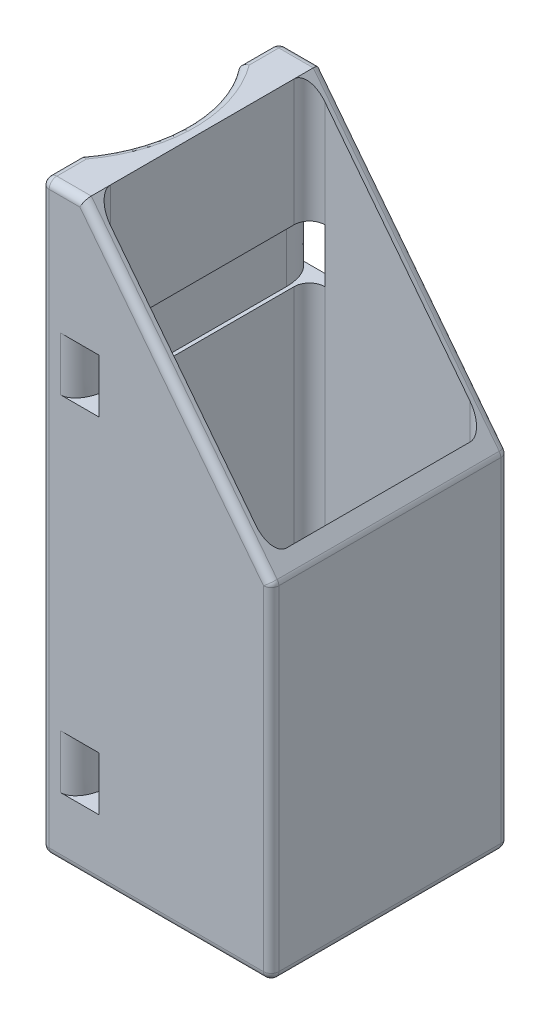
from build123d import *

# Parameters (mm, degrees)
SKETCH1_W           = 23
SKETCH1_H           = 28
BOSS_EXTRUDE1_DEPTH = 75
BOSS_EXTRUDE2_DEPTH = 1.5
CUT_EXTRUDE1_DEPTH  = 87.521673585
FILLET1_R           = 1
SKETCH7_W           = 2
SKETCH7_H           = 7
CUT_EXTRUDE2_DEPTH  = 87.521673672
SKETCH8_W           = 31
SKETCH8_H           = 7
CUT_EXTRUDE3_DEPTH  = 0.5
FILLET2_SIZE        = 2.5
FILLET2_SIZE_2      = 4
FILLET3_R           = 2


with BuildPart() as part:
    # Sketch1 → Boss-Extrude1 (new body)
    with BuildSketch(Plane(origin=(0, 0, 0), x_dir=(1, 0, 0), z_dir=(0, 1, 0))):
        with BuildLine():
            Line((0, 0), (30, 0))
            Line((30, 0), (30, 31))
            Line((30, 31), (0, 31))
            Line((0, 31), (0, 25.798058069))
            ThreePointArc((0, 25.798058069), (3.5, 15.5), (0, 5.201941931))
            Line((0, 5.201941931), (0, 0))
        make_face()
        with Locations((17, 15.5)):
            Rectangle(SKETCH1_W, SKETCH1_H, mode=Mode.SUBTRACT)
    extrude(amount=BOSS_EXTRUDE1_DEPTH)

    # Sketch2 → Boss-Extrude2 (add)
    with BuildSketch(Plane.XZ):
        with BuildLine():
            Line((0, -25.798058069), (0, -31))
            Line((0, -31), (30, -31))
            Line((30, -31), (30, 0))
            Line((30, 0), (0, 0))
            Line((0, 0), (0, -5.201941931))
            ThreePointArc((0, -5.201941931), (3.55300213, -15.5), (0, -25.798058069))
        make_face()
    extrude(amount=BOSS_EXTRUDE2_DEPTH)

    # Sketch6 → Cut-Extrude1 (cut, through all)
    with BuildSketch(Plane.XY):
        Polygon((5.5, 75), (30, 43.5), (30, 75), align=None)
    extrude(amount=-CUT_EXTRUDE1_DEPTH, mode=Mode.SUBTRACT)

    # Fillet1
    fillet1_edges = [part.edges().sort_by_distance(p)[0] for p in [
        (0, 36.75, -31),
        (0, 36.75, 0),
        (0, 75, -28.399029035),
        (3.5, 75, -15.5),
        (0, -1.5, -2.600970965),
        (3.55300213, -1.5, -15.5),
        (0, -1.5, -28.399029035),
        (15, -1.5, -31),
        (30, -1.5, -15.5),
        (15, -1.5, 0),
        (0, 75, -2.600970965),
        (30, 21, -31),
        (2.75, 75, -31),
        (30, 21, 0),
        (17.75, 59.25, -31),
        (30, 43.5, -15.5),
        (17.75, 59.25, 0),
        (2.75, 75, 0),
    ]]
    fillet(fillet1_edges, radius=FILLET1_R)

    # Sketch7 → Cut-Extrude2 (cut, through all)
    with BuildSketch(Plane.XY):
        with Locations((6.5, 55)):
            Rectangle(SKETCH7_W, SKETCH7_H)
        with Locations((6.5, 10)):
            Rectangle(SKETCH7_W, SKETCH7_H)
    extrude(amount=-CUT_EXTRUDE2_DEPTH, mode=Mode.SUBTRACT)

    # Sketch8 → Cut-Extrude3 (cut)
    with BuildSketch(Plane(origin=(5.5, 0, 0), x_dir=(0, 0, -1), z_dir=(1, 0, 0))):
        with Locations((15.5, 55)):
            Rectangle(SKETCH8_W, SKETCH8_H)
        with Locations((15.5, 10)):
            Rectangle(SKETCH8_W, SKETCH8_H)
    extrude(amount=-CUT_EXTRUDE3_DEPTH, mode=Mode.SUBTRACT)

    # Fillet2
    # an asymmetric fillet: 4, 2.5 mm, written as the material it takes off along each edge
    with BuildSketch(Plane(origin=(5, 6.5, -31), x_dir=(-1, 0, 0), z_dir=(0, 1, 0)), Plane(origin=(5, 13.5, 0), x_dir=(-1, 0, 0), z_dir=(0, -1, 0))) as fillet2_piece_1:
        with BuildLine():
            Bezier((FILLET2_SIZE, 0), (0, 0), (0, FILLET2_SIZE_2), weights=[1, 0.707106781, 1])
            Line((0, FILLET2_SIZE_2), (0, 0))
            Line((0, 0), (FILLET2_SIZE, 0))
        make_face()
    extrude(amount=7, mode=Mode.SUBTRACT)
    with BuildSketch(Plane(origin=(5, 58.5, -31), x_dir=(-1, 0, 0), z_dir=(0, -1, 0)), Plane(origin=(5, 51.5, 0), x_dir=(-1, 0, 0), z_dir=(0, 1, 0))) as fillet2_piece_2:
        with BuildLine():
            Bezier((FILLET2_SIZE, 0), (0, 0), (0, -FILLET2_SIZE_2), weights=[1, 0.707106781, 1])
            Line((0, -FILLET2_SIZE_2), (0, 0))
            Line((0, 0), (FILLET2_SIZE, 0))
        make_face()
    extrude(amount=7, mode=Mode.SUBTRACT)

    # Fillet3
    fillet3_edges = [part.edges().sort_by_distance(p)[0] for p in [
        (5.5, 32.5, -29.5),
        (5.5, 3.25, -29.5),
        (5.5, 32.5, -1.5),
        (5.5, 3.25, -1.5),
        (5.5, 0, -15.5),
        (5.5, 66.75, -29.5),
        (17, 0, -1.5),
        (5.5, 66.75, -1.5),
        (28.5, 0, -15.5),
        (17, 0, -29.5),
        (28.5, 22.714285714, -29.5),
        (28.5, 22.714285714, -1.5),
    ]]
    fillet(fillet3_edges, radius=FILLET3_R)


solid = part.part
